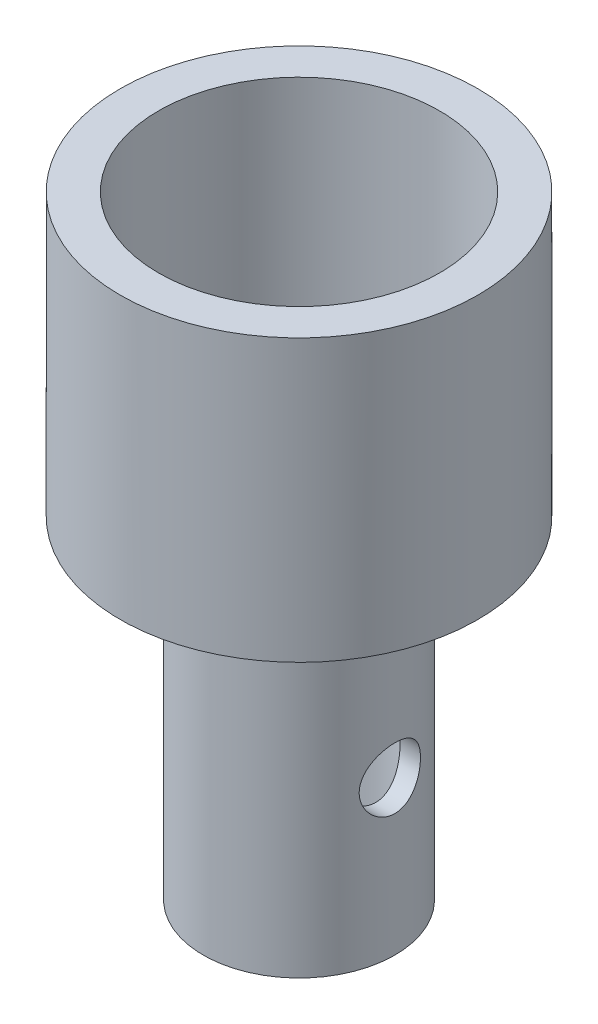
from build123d import *

# Parameters (mm, degrees)
SKETCH1_R            = 22.225
SKETCH1_R_2          = 17.4625
SPRING_CHAMBER_DEPTH = 28.575
BALL_CHAMBER_START   = 47.625
SKETCH2_R            = 22.225
SKETCH2_R_2          = 9.525
BALL_CHAMBER_DEPTH   = 47.625
SKETCH5_R            = 3.81
BALL_HOLE_DEPTH      = 58.061737399
SKETCH8_R            = 22.225
SKETCH8_R_2          = 11.90625
CUT_EXTRUDE2_DEPTH   = 41.275


with BuildPart() as part:
    # Sketch1 → spring_chamber (new body)
    with BuildSketch(Plane(origin=(0, 0, 0), x_dir=(1, 0, 0), z_dir=(0, 1, 0))):
        with Locations(Location((0, 0, 0), (0, 0, 270))):
            Circle(SKETCH1_R)
        with Locations(Location((0, 0, 0), (0, 0, 270))):
            Circle(SKETCH1_R_2, mode=Mode.SUBTRACT)
    extrude(amount=SPRING_CHAMBER_DEPTH)

    # Sketch2 → ball_chamber (add)
    with BuildSketch(Plane.XZ.offset(BALL_CHAMBER_START)):
        with Locations(Location((0, 0, 0), (0, 0, 270))):
            Circle(SKETCH2_R)
        with Locations(Location((0, 0, 0), (0, 0, 270))):
            Circle(SKETCH2_R_2, mode=Mode.SUBTRACT)
    extrude(amount=-BALL_CHAMBER_DEPTH)

    # Sketch5 → ball_hole (cut, through all)
    with BuildSketch(Plane(origin=(0, 0, 0), x_dir=(0, 0, -1), z_dir=(1, 0, 0))):
        with Locations(Location((0, -28.575, 0), (0, 0, 180))):
            Circle(SKETCH5_R)
    ball_hole = extrude(amount=BALL_HOLE_DEPTH, mode=Mode.SUBTRACT)

    # Sketch8 → Cut-Extrude2 (cut)
    with BuildSketch(Plane.XZ.offset(47.625)):
        with Locations(Location((0, 0, 0), (0, 0, 270))):
            Circle(SKETCH8_R)
        with Locations(Location((0, 0, 0), (0, 0, 270))):
            Circle(SKETCH8_R_2, mode=Mode.SUBTRACT)
    extrude(amount=-CUT_EXTRUDE2_DEPTH, mode=Mode.SUBTRACT)

    # Mirror1: ball_hole across plane
    add(ball_hole.mirror(Plane(origin=(0, 0, 0), x_dir=(0, 0, 1), z_dir=(1, 0, 0))), mode=Mode.SUBTRACT)


solid = part.part
